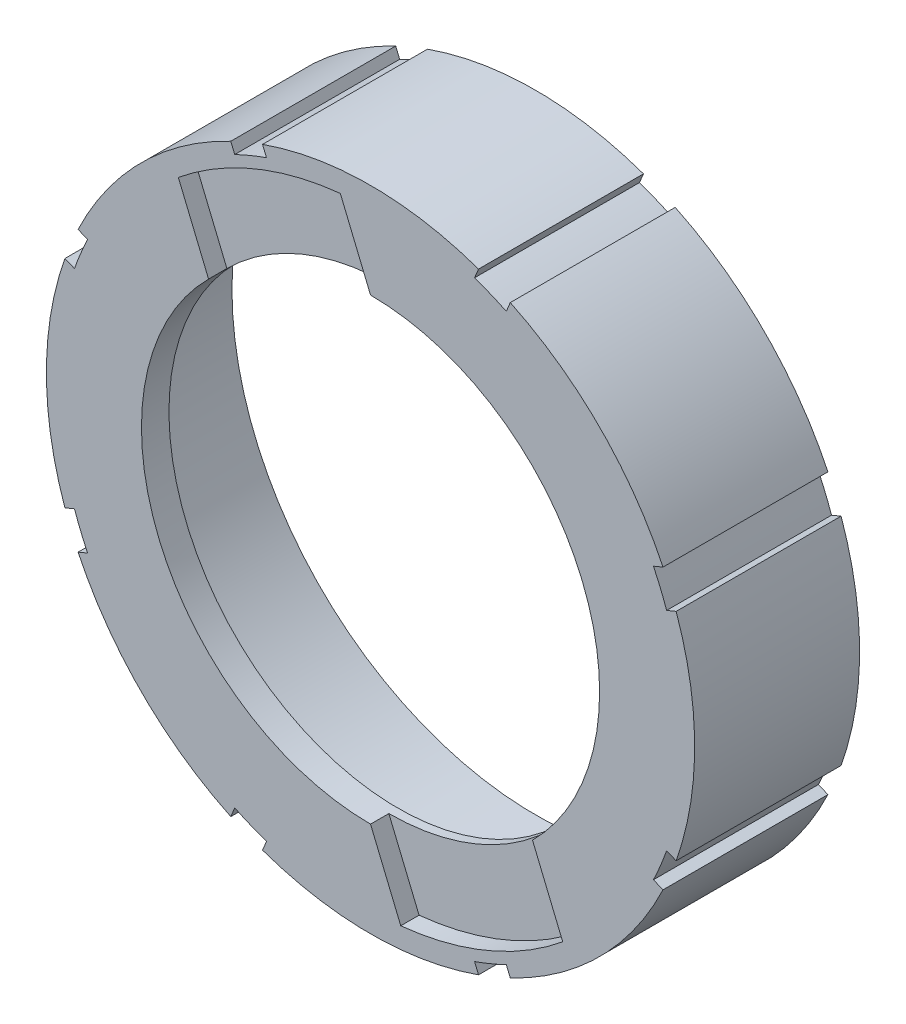
from build123d import *

# Parameters (mm, degrees)
SKETCH1_R           = 14.15
SKETCH1_R_2         = 13.25
BOSS_EXTRUDE1_DEPTH = 6
BOSS_EXTRUDE2_START = 1.2
SKETCH2_R           = 14.15
SKETCH2_R_2         = 10
BOSS_EXTRUDE2_DEPTH = 1.2
CUT_EXTRUDE2_DEPTH  = 0.8
CUT_EXTRUDE3_DEPTH  = 22.266993205
CIRPATTERN1_COUNT   = 8


with BuildPart() as part:
    # Sketch1 → Boss-Extrude1 (new body)
    with BuildSketch(Plane.XY):
        Circle(SKETCH1_R)
        Circle(SKETCH1_R_2, mode=Mode.SUBTRACT)
    extrude(amount=-BOSS_EXTRUDE1_DEPTH)

    # Sketch2 → Boss-Extrude2 (add)
    with BuildSketch(Plane.XY.offset(BOSS_EXTRUDE2_START)):
        Circle(SKETCH2_R)
        Circle(SKETCH2_R_2, mode=Mode.SUBTRACT)
    extrude(amount=-BOSS_EXTRUDE2_DEPTH)

    # Sketch4 → Cut-Extrude2 (cut)
    with BuildSketch(Plane.XY.offset(1.2)):
        with BuildLine():
            ThreePointArc((1.318935367, -13.184191651), (5.070555479, -12.241403806), (8.390003179, -10.255259463))
            Line((8.390003179, -10.255259463), (7.071067812, -7.071067812))
            ThreePointArc((7.071067812, -7.071067812), (3.826834324, -9.238795325), (0, -10))
            Line((0, -10), (1.318935367, -13.184191651))
        make_face()
        with BuildLine():
            ThreePointArc((-7.071067812, 7.071067812), (-3.826834324, 9.238795325), (0, 10))
            Line((0, 10), (-1.318935367, 13.184191651))
            ThreePointArc((-1.318935367, 13.184191651), (-5.070555479, 12.241403806), (-8.390003179, 10.255259463))
            Line((-8.390003179, 10.255259463), (-7.071067812, 7.071067812))
        make_face()
    extrude(amount=-CUT_EXTRUDE2_DEPTH, mode=Mode.SUBTRACT)

    # Sketch5 → Cut-Extrude3 (cut, through all)
    with BuildSketch(Plane(origin=(0, 0, -6), x_dir=(-1, 0, 0), z_dir=(0, 0, -1))):
        with BuildLine():
            ThreePointArc((6.100268527, 12.767506565), (5.414970568, 13.072895385), (4.714449228, 13.341531714))
            Line((4.714449228, 13.341531714), (4.541991295, 12.925181433))
            ThreePointArc((4.541991295, 12.925181433), (5.242763023, 12.657149595), (5.927810594, 12.351156284))
            Line((5.927810594, 12.351156284), (6.100268527, 12.767506565))
        make_face()
    cut_extrude3 = extrude(amount=-CUT_EXTRUDE3_DEPTH, mode=Mode.SUBTRACT)

    # CirPattern1: Cut-Extrude3 ×8 about axis
    cirpattern1_axis = Axis((0, 0, 0), (0, 0, 1))
    for i in range(1, CIRPATTERN1_COUNT):
        add(cut_extrude3.rotate(cirpattern1_axis, i * 360 / CIRPATTERN1_COUNT), mode=Mode.SUBTRACT)


solid = part.part
